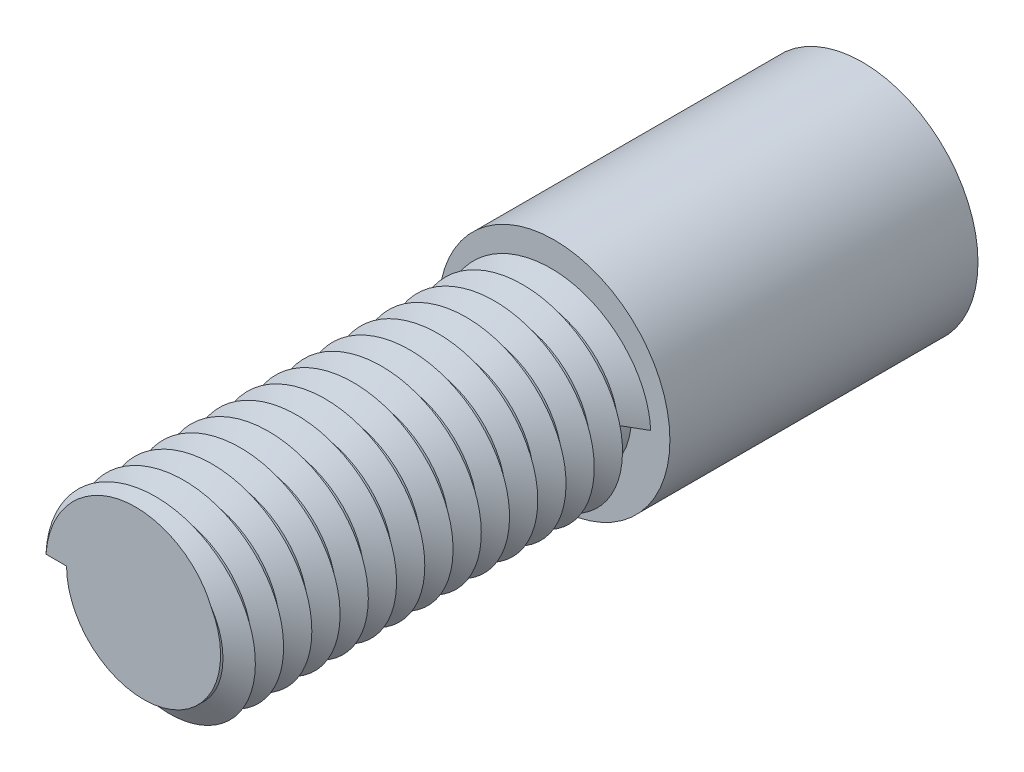
from build123d import *

# Parameters (mm, degrees)
SKETCH1_R           = 1.5
BOSS_EXTRUDE1_DEPTH = 8
SKETCH2_R           = 2.25
BOSS_EXTRUDE2_DEPTH = 6
SKETCH3_R           = 1.5
CUT_EXTRUDE1_DEPTH  = 4.5
SWEEP1_PITCH        = 0.55
SKETCH6_R           = 2.601396782
CUT_EXTRUDE2_DEPTH  = 1


with BuildPart() as part:
    # Sketch1 → Boss-Extrude1 (new body)
    with BuildSketch(Plane.XY):
        Circle(SKETCH1_R)
    extrude(amount=BOSS_EXTRUDE1_DEPTH)

    # Sketch2 → Boss-Extrude2 (add)
    with BuildSketch(Plane(origin=(0, 0, 0), x_dir=(-1, 0, 0), z_dir=(0, 0, -1))):
        Circle(SKETCH2_R)
    extrude(amount=BOSS_EXTRUDE2_DEPTH)

    # Sketch3 → Cut-Extrude1 (cut)
    with BuildSketch(Plane(origin=(0, 0, -6), x_dir=(-1, 0, 0), z_dir=(0, 0, -1))):
        Circle(SKETCH3_R)
    extrude(amount=-CUT_EXTRUDE1_DEPTH, mode=Mode.SUBTRACT)

    # Sweep1: the profile of Sketch5 screwed along a right-hand helix of 14.5 turns, 6 arcs to a turn; built about Z, then put on its axis
    sweep1_z = Axis((0, 0, 0), (0, 0, 1))
    sweep1_corners = [(1.9, 0, 0), (1.3, 0, -0.346410162), (1.3, 0, 0.346410162)]
    with BuildLine(mode=Mode.PRIVATE) as sweep1_profile:
        Line(sweep1_corners[0], sweep1_corners[1])
        Line(sweep1_corners[1], sweep1_corners[2])
        Line(sweep1_corners[2], sweep1_corners[0])
    sweep1_cap = Face(sweep1_profile.wire())
    sweep1_turn_angles = [0, 30, 60, 90, 120, 150, 180, 210, 240, 270, 300, 330, 360]
    sweep1_turn_weights = [1, 0.8660254037844387, 1, 0.8660254037844387, 1, 0.8660254037844387, 1, 0.8660254037844387, 1, 0.8660254037844387, 1, 0.8660254037844387, 1]
    sweep1_turn_rails = [Edge.make_bspline([Vector(p[0], p[1], 0).rotate(sweep1_z, sweep1_turn_angles[k]) / sweep1_turn_weights[k] + Vector(0, 0, p[2] + SWEEP1_PITCH * sweep1_turn_angles[k] / 360) for k in range(13)], [0, 0, 0, 1, 1, 2, 2, 3, 3, 4, 4, 5, 5, 6, 6, 6], 2, sweep1_turn_weights) for p in sweep1_corners]
    sweep1_turn_sides = [Face.make_surface_from_curves(sweep1_turn_rails[p[0]], sweep1_turn_rails[p[1]]) for p in [(0, 1), (1, 2), (2, 0)]]
    sweep1_last_angles = [5040, 5070, 5100, 5130, 5160, 5190, 5220]
    sweep1_last_weights = [1, 0.8660254037844387, 1, 0.8660254037844387, 1, 0.8660254037844546, 1]
    sweep1_last_rails = [Edge.make_bspline([Vector(p[0], p[1], 0).rotate(sweep1_z, sweep1_last_angles[k]) / sweep1_last_weights[k] + Vector(0, 0, p[2] + SWEEP1_PITCH * sweep1_last_angles[k] / 360) for k in range(7)], [0, 0, 0, 1, 1, 2, 2, 3, 3, 3], 2, sweep1_last_weights) for p in sweep1_corners]
    sweep1_last_sides = [Face.make_surface_from_curves(sweep1_last_rails[p[0]], sweep1_last_rails[p[1]]) for p in [(0, 1), (1, 2), (2, 0)]]
    sweep1 = Plane(origin=(0, 0, 8), x_dir=(-1, 0, 0), z_dir=(0, 0, -1)) * Solid(Shell([*[p.moved(Location((0, 0, SWEEP1_PITCH * i))) for i in range(14) for p in sweep1_turn_sides], *sweep1_last_sides, sweep1_cap, sweep1_cap.rotate(sweep1_z, 5220).moved(Location((0, 0, SWEEP1_PITCH * 5220 / 360)))]))
    add(sweep1)

    # Sketch6 → Cut-Extrude2 (cut)
    with BuildSketch(Plane.XY.offset(8)):
        Circle(SKETCH6_R)
    extrude(amount=CUT_EXTRUDE2_DEPTH, mode=Mode.SUBTRACT)


solid = part.part
